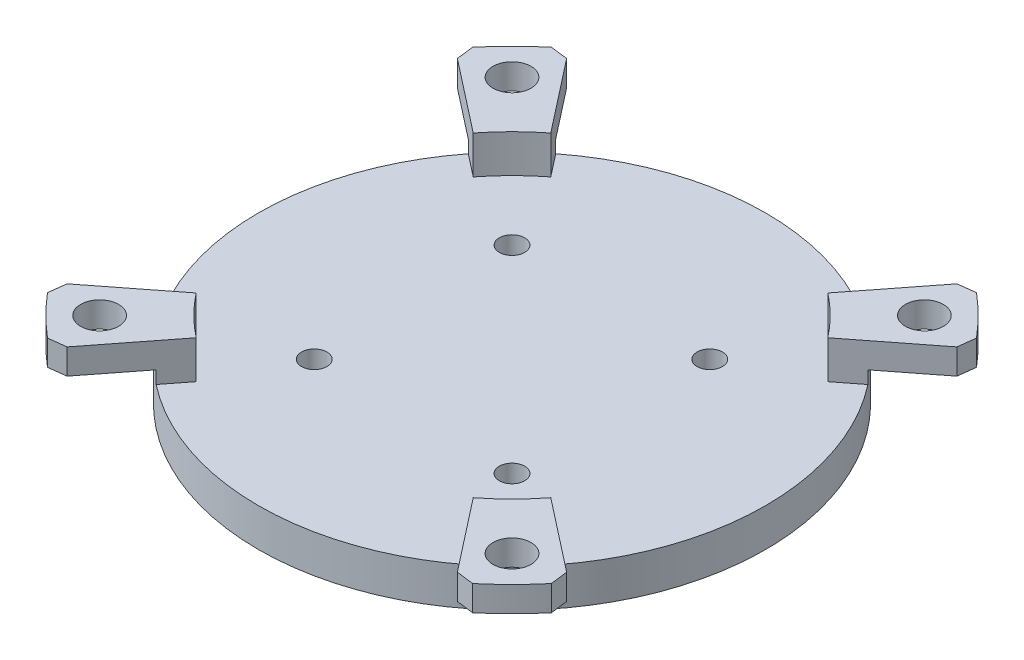
from build123d import *
from build123d.topology import SkipClean

# Parameters (mm, degrees)
SKETCH1_R           = 20
SKETCH1_R_2         = 1
BOSS_EXTRUDE1_DEPTH = 3
BOSS_EXTRUDE2_DEPTH = 3
BOSS_EXTRUDE3_START = -2
BOSS_EXTRUDE3_DEPTH = 2
SKETCH4_R           = 1.5
CUT_EXTRUDE1_DEPTH  = 2
CHAMFER2_SIZE       = 1


with BuildPart() as part:
    # Sketch1 → Boss-Extrude1 (new body)
    with BuildSketch(Plane(origin=(0, 0, 0), x_dir=(1, 0, 0), z_dir=(0, 1, 0))):
        with Locations(Location((0, 0, 0), (0, 0, 270))):
            Circle(SKETCH1_R)
        with Locations(Location((-7.8, 7.8, 0), (0, 0, 270))):
            Circle(SKETCH1_R_2, mode=Mode.SUBTRACT)
        with Locations(Location((7.8, 7.8, 0), (0, 0, 270))):
            Circle(SKETCH1_R_2, mode=Mode.SUBTRACT)
        with Locations(Location((7.8, -7.8, 0), (0, 0, 270))):
            Circle(SKETCH1_R_2, mode=Mode.SUBTRACT)
        with Locations(Location((-7.8, -7.8, 0), (0, 0, 270))):
            Circle(SKETCH1_R_2, mode=Mode.SUBTRACT)
    extrude(amount=BOSS_EXTRUDE1_DEPTH)

    # Sketch2 → Boss-Extrude2 (add)
    with SkipClean():  # the faces are left unmerged after this step: merging them gives an invalid solid
        with BuildSketch(Plane(origin=(0, 3, 0), x_dir=(1, 0, 0), z_dir=(0, 1, 0))):
            with BuildLine():
                Line((-10.926328273, 13.985062443), (-12.313229507, 15.760215072))
                ThreePointArc((-12.313229507, 15.760215072), (-14.142135624, 14.142135624), (-15.760215072, 12.313229507))
                Line((-15.760215072, 12.313229507), (-13.985062443, 10.926328273))
                ThreePointArc((-13.985062443, 10.926328273), (-12.549235456, 12.549235456), (-10.926328273, 13.985062443))
            make_face()
            with BuildLine():
                Line((10.926328273, 13.985062443), (12.313229507, 15.760215072))
                ThreePointArc((12.313229507, 15.760215072), (14.142135624, 14.142135624), (15.760215072, 12.313229507))
                Line((15.760215072, 12.313229507), (13.985062443, 10.926328273))
                ThreePointArc((13.985062443, 10.926328273), (12.549235456, 12.549235456), (10.926328273, 13.985062443))
            make_face()
            with BuildLine():
                Line((13.985062443, -10.926328273), (15.760215072, -12.313229507))
                ThreePointArc((15.760215072, -12.313229507), (14.142135624, -14.142135624), (12.313229507, -15.760215072))
                Line((12.313229507, -15.760215072), (10.926328273, -13.985062443))
                ThreePointArc((10.926328273, -13.985062443), (12.549235456, -12.549235456), (13.985062443, -10.926328273))
            make_face()
            with BuildLine():
                Line((-10.926328273, -13.985062443), (-12.313229507, -15.760215072))
                ThreePointArc((-12.313229507, -15.760215072), (-14.142135624, -14.142135624), (-15.760215072, -12.313229507))
                Line((-15.760215072, -12.313229507), (-13.985062443, -10.926328273))
                ThreePointArc((-13.985062443, -10.926328273), (-12.549235456, -12.549235456), (-10.926328273, -13.985062443))
            make_face()
        extrude(amount=BOSS_EXTRUDE2_DEPTH)

    # Sketch3 → Boss-Extrude3 (add)
    with SkipClean():  # the faces are left unmerged after this step: merging them gives an invalid solid
        with BuildSketch(Plane(origin=(0, 6, 0), x_dir=(1, 0, 0), z_dir=(0, 1, 0)).offset(BOSS_EXTRUDE3_START)):
            with BuildLine():
                Line((12.313229507, 15.760215072), (16.007198358, 20.488279594))
                ThreePointArc((16.007198358, 20.488279594), (18.384776311, 18.384776311), (20.488279594, 16.007198358))
                Line((20.488279594, 16.007198358), (15.760215072, 12.313229507))
                ThreePointArc((15.760215072, 12.313229507), (14.142135624, 14.142135624), (12.313229507, 15.760215072))
            make_face()
            with BuildLine():
                Line((-12.313229507, 15.760215072), (-16.007198358, 20.488279594))
                ThreePointArc((-16.007198358, 20.488279594), (-18.384776311, 18.384776311), (-20.488279594, 16.007198358))
                Line((-20.488279594, 16.007198358), (-15.760215072, 12.313229507))
                ThreePointArc((-15.760215072, 12.313229507), (-14.142135624, 14.142135624), (-12.313229507, 15.760215072))
            make_face()
            with BuildLine():
                Line((15.760215072, -12.313229507), (20.488279594, -16.007198358))
                ThreePointArc((20.488279594, -16.007198358), (18.384776311, -18.384776311), (16.007198358, -20.488279594))
                Line((16.007198358, -20.488279594), (12.313229507, -15.760215072))
                ThreePointArc((12.313229507, -15.760215072), (14.142135624, -14.142135624), (15.760215072, -12.313229507))
            make_face()
            with BuildLine():
                Line((-12.313229507, -15.760215072), (-16.007198358, -20.488279594))
                ThreePointArc((-16.007198358, -20.488279594), (-18.384776311, -18.384776311), (-20.488279594, -16.007198358))
                Line((-20.488279594, -16.007198358), (-15.760215072, -12.313229507))
                ThreePointArc((-15.760215072, -12.313229507), (-14.142135624, -14.142135624), (-12.313229507, -15.760215072))
            make_face()
        extrude(amount=BOSS_EXTRUDE3_DEPTH)

    # Sketch4 → Cut-Extrude1 (cut)
    with SkipClean():  # the faces are left unmerged after this step: merging them gives an invalid solid
        with BuildSketch(Plane.XZ.offset(-4)):
            with Locations(Location((-16.263455967, -16.263455967, 0), (0, 0, 270))):
                Circle(SKETCH4_R)
            with Locations(Location((-16.263455967, 16.263455967, 0), (0, 0, 270))):
                Circle(SKETCH4_R)
            with Locations(Location((16.263455967, 16.263455967, 0), (0, 0, 270))):
                Circle(SKETCH4_R)
            with Locations(Location((16.263455967, -16.263455967, 0), (0, 0, 270))):
                Circle(SKETCH4_R)
        extrude(amount=-CUT_EXTRUDE1_DEPTH, mode=Mode.SUBTRACT)

    # Chamfer2
    # the kernel refuses this chamfer: 1 mm, written as the material it takes off along each edge
    with BuildSketch(Plane(origin=(-16.007198358, 1.428317012, 20.488279594), x_dir=(0.615661475325629, 0, -0.788010753606745), z_dir=(0, 1, 0)), Plane(origin=(20.488279594, 1.428317012, 16.007198358), x_dir=(-0.7880107536067236, 0, -0.6156614753256563), z_dir=(0, 1, 0)), Plane(origin=(16.007198358, 1.428317012, -20.488279594), x_dir=(-0.6156614753256462, 0, 0.7880107536067315), z_dir=(0, 1, 0)), Plane(origin=(-20.488279594, 1.428317012, -16.007198358), x_dir=(0.7880107536067239, 0, 0.6156614753256557), z_dir=(0, 1, 0))) as chamfer2_piece_1:
        with BuildLine():
            Line((CHAMFER2_SIZE, 0), (0.018531237, 0.981468763))
            ThreePointArc((0.018531237, 0.981468763), (0.004898706, 0.504686734), (0, 0))
            Line((0, 0), (CHAMFER2_SIZE, 0))
        make_face()
    extrude(amount=7.143365976, mode=Mode.SUBTRACT)
    with BuildSketch(Plane(origin=(-20.488279594, 1.428317012, 16.007198358), x_dir=(0.7880107536066959, 0, -0.6156614753256917), z_dir=(0, 1, 0)), Plane(origin=(16.007198358, 1.428317012, 20.488279594), x_dir=(-0.6156614753256615, 0, -0.7880107536067196), z_dir=(0, 1, 0)), Plane(origin=(20.488279594, 1.428317012, -16.007198358), x_dir=(-0.7880107536067122, 0, 0.615661475325671), z_dir=(0, 1, 0)), Plane(origin=(-16.007198358, 1.428317012, -20.488279594), x_dir=(0.615661475325662, 0, 0.7880107536067191), z_dir=(0, 1, 0))) as chamfer2_piece_2:
        with BuildLine():
            Line((CHAMFER2_SIZE, 0), (0.018531237, -0.981468763))
            ThreePointArc((0.018531237, -0.981468763), (0.004898706, -0.504686734), (0, 0))
            Line((0, 0), (CHAMFER2_SIZE, 0))
        make_face()
    extrude(amount=7.143365976, mode=Mode.SUBTRACT)


solid = part.part
